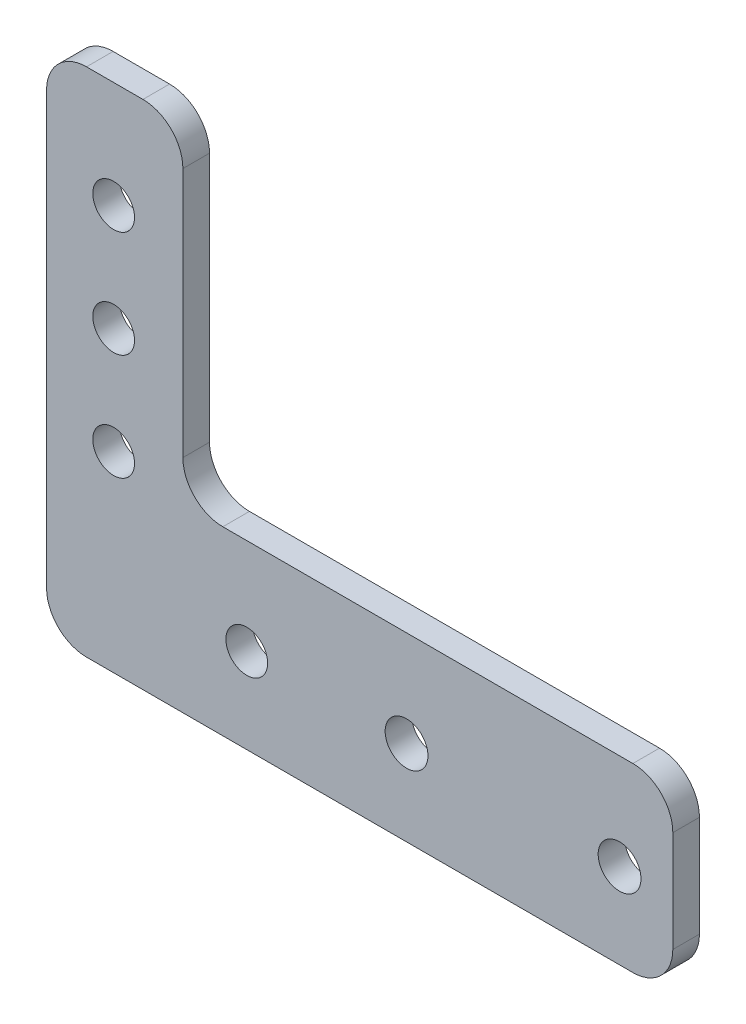
from build123d import *

# Parameters (mm, degrees)
SKETCH1_R           = 2.4892
SKETCH1_R_2         = 2.5527
BOSS_EXTRUDE1_DEPTH = 3.175
FILLET1_R           = 4.7625


with BuildPart() as part:
    # Sketch1 → Boss-Extrude1 (new body)
    with BuildSketch(Plane.XY):
        Polygon((-33.401, 31.75), (-33.401, -29.21), (41.275, -29.21), (41.275, -7.62), (-17.145, -7.62), (-17.145, 31.75), align=None)
        with Locations((-9.525, -19.05)):
            Circle(SKETCH1_R, mode=Mode.SUBTRACT)
        with Locations((-25.4, -6.35)):
            Circle(SKETCH1_R, mode=Mode.SUBTRACT)
        with Locations((9.525, -19.05)):
            Circle(SKETCH1_R_2, mode=Mode.SUBTRACT)
        with Locations((34.925, -19.05)):
            Circle(SKETCH1_R_2, mode=Mode.SUBTRACT)
        with Locations((-25.4, 6.35)):
            Circle(SKETCH1_R, mode=Mode.SUBTRACT)
        with Locations((-25.4, 19.05)):
            Circle(SKETCH1_R, mode=Mode.SUBTRACT)
    extrude(amount=BOSS_EXTRUDE1_DEPTH)

    # Fillet1
    fillet1_edges = [part.edges().sort_by_distance(p)[0] for p in [
        (-33.401, 31.75, 1.5875),
        (-17.145, 31.75, 1.5875),
        (-17.145, -7.62, 1.5875),
        (41.275, -7.62, 1.5875),
        (41.275, -29.21, 1.5875),
        (-33.401, -29.21, 1.5875),
    ]]
    fillet(fillet1_edges, radius=FILLET1_R)


solid = part.part
